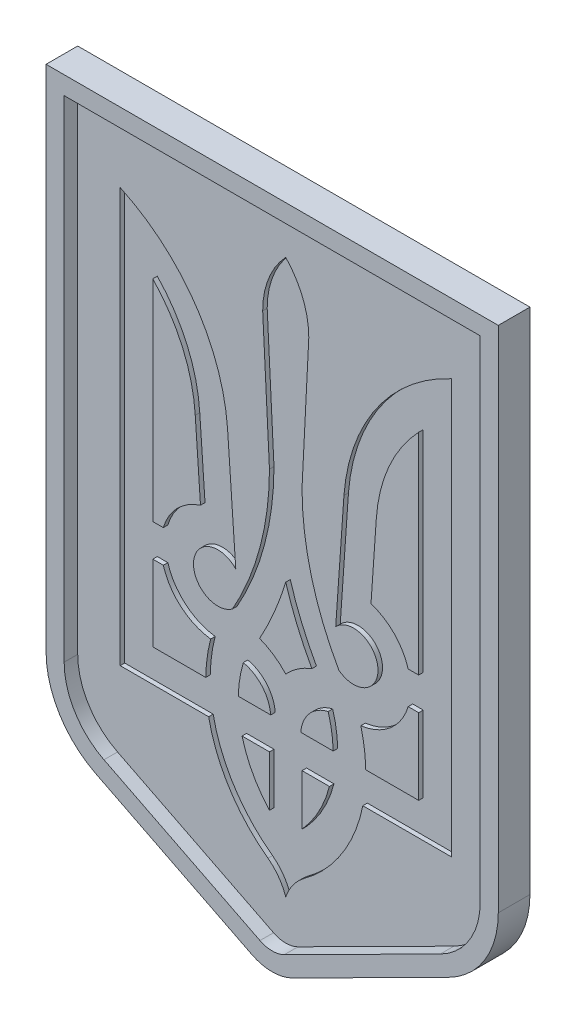
from build123d import *

# Parameters (mm, degrees)
EXTRUDE_1_DEPTH     = 2
EXTRUDE_2_DEPTH     = 1.5
OTHER_START         = 1.5
OTHER_1_DEPTH       = 0.5
CUT_EXTRUDE_1_DEPTH = 10


# Read off the part's stored shape, not the designer's step: Полость1
with BuildPart() as part:
    # Эскиз1 → Бобышка-Вытянуть1 (new body)
    with BuildSketch(Plane.XY):
        with BuildLine():
            Line((-2.248831138, 1.132455321), (-19.497662275, 9.818536847))
            ThreePointArc((-19.497662275, 9.818536847), (-23.514006776, 13.504841411), (-25, 18.75))
            Line((-25, 18.75), (-25, 75))
            Line((-25, 75), (25, 75))
            Line((25, 75), (25, 18.75))
            ThreePointArc((25, 18.75), (23.514006776, 13.504841411), (19.497662275, 9.818536847))
            Line((19.497662275, 9.818536847), (2.248831138, 1.132455321))
            ThreePointArc((2.248831138, 1.132455321), (0, 0.598186897), (-2.248831138, 1.132455321))
        make_face()
    extrude(amount=EXTRUDE_1_DEPTH)

    # Эскиз2 → Бобышка-Вытянуть2 (add)
    with BuildSketch(Plane.XY.offset(2)):
        with BuildLine():
            Line((25, 75), (-25, 75))
            Line((-25, 75), (-25, 18.75))
            ThreePointArc((-25, 18.75), (-23.514006776, 13.504841411), (-19.497662275, 9.818536847))
            Line((-19.497662275, 9.818536847), (-2.248831138, 1.132455321))
            ThreePointArc((-2.248831138, 1.132455321), (0, 0.598186897), (2.248831138, 1.132455321))
            Line((2.248831138, 1.132455321), (19.497662275, 9.818536847))
            ThreePointArc((19.497662275, 9.818536847), (23.514006776, 13.504841411), (25, 18.75))
            Line((25, 18.75), (25, 75))
        make_face()
        with BuildLine():
            Line((23, 73), (-23, 73))
            Line((-23, 73), (-23, 18.75))
            ThreePointArc((-23, 18.75), (-21.81120542, 14.553873129), (-18.59812982, 11.604829477))
            Line((-18.59812982, 11.604829477), (-1.349298683, 2.918747951))
            ThreePointArc((-1.349298683, 2.918747951), (0, 2.598186897), (1.349298683, 2.918747951))
            Line((1.349298683, 2.918747951), (18.59812982, 11.604829477))
            ThreePointArc((18.59812982, 11.604829477), (21.81120542, 14.553873129), (23, 18.75))
            Line((23, 18.75), (23, 73))
        make_face(mode=Mode.SUBTRACT)
    extrude(amount=EXTRUDE_2_DEPTH)

    # Полость1 outline → Полость1 (cut)
    with BuildSketch(Plane.XY.offset(OTHER_START)):
        with BuildLine():
            ThreePointArc((5.872817683, 36.335212556), (10.497140141, 33.683878279), (5.659180925, 31.446003782))
            ThreePointArc((5.659180925, 31.446003782), (2.557547726, 38.996194393), (1.5, 47.089840022))
            Line((1.5, 47.089840022), (2.25, 61.864840022))
            ThreePointArc((2.25, 61.864840022), (1.66872912, 65.046820537), (0, 67.817780472))
            ThreePointArc((0, 67.817780472), (-1.66872912, 65.046820537), (-2.25, 61.864840022))
            Line((-2.25, 61.864840022), (-1.5, 47.089840022))
            ThreePointArc((-1.5, 47.089840022), (-2.557547726, 38.996194393), (-5.659180925, 31.446003782))
            ThreePointArc((-5.659180925, 31.446003782), (-10.49714014, 33.683878279), (-5.872817683, 36.335212556))
            Line((-5.872817683, 36.335212556), (-6.73484174, 48.66273089))
            ThreePointArc((-6.73484174, 48.66273089), (-10.164455559, 58.47909234), (-18, 65.314840022))
            Line((-18, 65.314840022), (-18, 20.314840022))
            Line((-18, 20.314840022), (-8.27498074, 20.314840022))
            ThreePointArc((-8.27498074, 20.314840022), (-6.018005307, 14.531627185), (-1.78373039, 9.991758821))
            ThreePointArc((-1.78373039, 9.991758821), (-0.762703724, 9.010745514), (0, 7.817780472))
            ThreePointArc((0, 7.817780472), (0.762703724, 9.010745514), (1.78373039, 9.991758821))
            ThreePointArc((1.78373039, 9.991758821), (6.018005307, 14.531627185), (8.27498074, 20.314840022))
            Line((8.27498074, 20.314840022), (18, 20.314840022))
            Line((18, 20.314840022), (18, 65.314840022))
            ThreePointArc((18, 65.314840022), (10.164455559, 58.47909234), (6.73484174, 48.66273089))
            Line((6.73484174, 48.66273089), (5.872817683, 36.335212556))
        make_face()
        with BuildLine():
            ThreePointArc((-1.5, 13.673911644), (-3.833724688, 16.727440499), (-5.212446581, 20.314840022))
            Line((-5.212446581, 20.314840022), (-1.5, 20.314840022))
            Line((-1.5, 20.314840022), (-1.5, 13.673911644))
        make_face(mode=Mode.SUBTRACT)
        with BuildLine():
            ThreePointArc((-7.92032189, 27.82958067), (-8.391822285, 25.594060154), (-8.55, 23.314840022))
            Line((-8.55, 23.314840022), (-15, 23.314840022))
            Line((-15, 23.314840022), (-15, 32.314840022))
            Line((-15, 32.314840022), (-13.309475019, 32.314840022))
            ThreePointArc((-13.309475019, 32.314840022), (-11.338226185, 29.203113691), (-7.92032189, 27.82958067))
        make_face(mode=Mode.SUBTRACT)
        with BuildLine():
            ThreePointArc((-4.896666667, 27.463714033), (-2.35750881, 26.043942439), (-1.35, 23.314840022))
            Line((-1.35, 23.314840022), (-5.55, 23.314840022))
            ThreePointArc((-5.55, 23.314840022), (-5.385666463, 25.414840022), (-4.896666667, 27.463714033))
        make_face(mode=Mode.SUBTRACT)
        with BuildLine():
            Line((1.5, 13.673911644), (1.5, 20.314840022))
            Line((1.5, 20.314840022), (5.212446581, 20.314840022))
            ThreePointArc((5.212446581, 20.314840022), (3.833724688, 16.727440499), (1.5, 13.673911644))
        make_face(mode=Mode.SUBTRACT)
        with BuildLine():
            ThreePointArc((1.35, 23.314840022), (2.35750881, 26.043942439), (4.896666667, 27.463714033))
            ThreePointArc((4.896666667, 27.463714033), (5.385666463, 25.414840022), (5.55, 23.314840022))
            Line((5.55, 23.314840022), (1.35, 23.314840022))
        make_face(mode=Mode.SUBTRACT)
        with BuildLine():
            ThreePointArc((0, 38.259555712), (1.403302974, 34.104361284), (3.327405339, 30.163202817))
            ThreePointArc((3.327405339, 30.163202817), (1.502516133, 29.26949151), (0, 27.901505478))
            ThreePointArc((0, 27.901505478), (-1.502516133, 29.26949151), (-3.327405339, 30.163202817))
            ThreePointArc((-3.327405339, 30.163202817), (-1.403302974, 34.104361284), (0, 38.259555712))
        make_face(mode=Mode.SUBTRACT)
        with BuildLine():
            ThreePointArc((8.55, 23.314840022), (8.391822285, 25.594060154), (7.92032189, 27.82958067))
            ThreePointArc((7.92032189, 27.82958067), (11.338226185, 29.203113691), (13.309475019, 32.314840022))
            Line((13.309475019, 32.314840022), (15, 32.314840022))
            Line((15, 32.314840022), (15, 23.314840022))
            Line((15, 23.314840022), (8.55, 23.314840022))
        make_face(mode=Mode.SUBTRACT)
        with BuildLine():
            ThreePointArc((-9.108112452, 39.595322211), (-11.782030233, 38.017722019), (-13.309475019, 35.314840022))
            Line((-13.309475019, 35.314840022), (-15, 35.314840022))
            Line((-15, 35.314840022), (-15, 59.587599146))
            ThreePointArc((-15, 59.587599146), (-11.277427711, 54.369586152), (-9.706680997, 48.155251207))
            Line((-9.706680997, 48.155251207), (-9.108112452, 39.595322211))
        make_face(mode=Mode.SUBTRACT)
        with BuildLine():
            ThreePointArc((9.706680998, 48.155251207), (11.277427711, 54.369586152), (15, 59.587599146))
            Line((15, 59.587599146), (15, 35.314840022))
            Line((15, 35.314840022), (13.309475019, 35.314840022))
            ThreePointArc((13.309475019, 35.314840022), (11.782030233, 38.017722019), (9.108112452, 39.595322211))
            Line((9.108112452, 39.595322211), (9.706680998, 48.155251207))
        make_face(mode=Mode.SUBTRACT)
    extrude(amount=OTHER_1_DEPTH, mode=Mode.SUBTRACT)

    # Эскиз3 → Вырез-Вытянуть1 (cut)
    with BuildSketch(Plane.XY.offset(1.5)):
        with BuildLine():
            Line((-18.3, 65.79134502), (-18.3, 20.014840022))
            Line((-18.3, 20.014840022), (-8.522704696, 20.014840022))
            ThreePointArc((-8.522704696, 20.014840022), (-6.205709985, 14.267416366), (-1.962700971, 9.75097776))
            ThreePointArc((-1.962700971, 9.75097776), (-0.776140503, 8.53640523), (0, 7.026200576))
            ThreePointArc((0, 7.026200576), (0.776140503, 8.53640523), (1.962700971, 9.75097776))
            ThreePointArc((1.962700971, 9.75097776), (6.205709985, 14.267416366), (8.522704696, 20.014840022))
            Line((8.522704696, 20.014840022), (18.3, 20.014840022))
            Line((18.3, 20.014840022), (18.3, 65.79134502))
            ThreePointArc((18.3, 65.79134502), (10.051283209, 58.844723617), (6.435652247, 48.684797911))
            Line((6.435652247, 48.684797911), (5.524546517, 35.655378948))
            ThreePointArc((5.524546517, 35.655378948), (10.188878559, 34.059650346), (5.889417806, 31.647808643))
            ThreePointArc((5.889417806, 31.647808643), (2.840648904, 39.098998924), (1.800000924, 47.0822489))
            Line((1.800000924, 47.0822489), (2.549996836, 61.857168373))
            ThreePointArc((2.549996836, 61.857168373), (1.8904299, 65.304748617), (0, 68.262300456))
            ThreePointArc((0, 68.262300456), (-1.8904299, 65.304748617), (-2.549996836, 61.857168373))
            Line((-2.549996836, 61.857168373), (-1.800000923, 47.0822489))
            ThreePointArc((-1.800000923, 47.0822489), (-2.840648904, 39.098998924), (-5.889417806, 31.647808643))
            ThreePointArc((-5.889417806, 31.647808643), (-10.188878559, 34.059650346), (-5.524546517, 35.655378948))
            Line((-5.524546517, 35.655378948), (-6.435652247, 48.684797911))
            ThreePointArc((-6.435652247, 48.684797911), (-10.051283209, 58.844723617), (-18.3, 65.79134502))
        make_face()
        with BuildLine():
            Line((-14.7, 58.862618748), (-14.7, 35.614840022))
            Line((-14.7, 35.614840022), (-13.537383539, 35.614840022))
            ThreePointArc((-13.537383539, 35.614840022), (-12.000472829, 38.223438928), (-9.424123799, 39.813818902))
            Line((-9.424123799, 39.813818902), (-10.006037257, 48.13556906))
            ThreePointArc((-10.006037257, 48.13556906), (-11.401876329, 53.915296555), (-14.7, 58.862618748))
        make_face(mode=Mode.SUBTRACT)
        with BuildLine():
            Line((10.006037257, 48.13556906), (9.424123799, 39.813818902))
            ThreePointArc((9.424123799, 39.813818902), (12.000472829, 38.223438928), (13.537383539, 35.614840022))
            Line((13.537383539, 35.614840022), (14.7, 35.614840022))
            Line((14.7, 35.614840022), (14.7, 58.862618748))
            ThreePointArc((14.7, 58.862618748), (11.401876329, 53.915296555), (10.006037257, 48.13556906))
        make_face(mode=Mode.SUBTRACT)
        with BuildLine():
            Line((8.847321215, 23.614840022), (14.7, 23.614840022))
            Line((14.7, 23.614840022), (14.7, 32.014840022))
            Line((14.7, 32.014840022), (13.537383539, 32.014840022))
            ThreePointArc((13.537383539, 32.014840022), (11.579925154, 29.014401424), (8.303170174, 27.566246767))
            ThreePointArc((8.303170174, 27.566246767), (8.692930904, 25.606749909), (8.847321215, 23.614840022))
        make_face(mode=Mode.SUBTRACT)
        with BuildLine():
            Line((-5.246590469, 23.614840022), (-1.661555581, 23.614840022))
            ThreePointArc((-1.661555581, 23.614840022), (-2.599333734, 25.86504954), (-4.69, 27.118837919))
            ThreePointArc((-4.69, 27.118837919), (-5.086558291, 25.385624396), (-5.246590469, 23.614840022))
        make_face(mode=Mode.SUBTRACT)
        with BuildLine():
            Line((1.661555581, 23.614840022), (5.246590469, 23.614840022))
            ThreePointArc((5.246590469, 23.614840022), (5.086558291, 25.385624396), (4.69, 27.118837919))
            ThreePointArc((4.69, 27.118837919), (2.599333734, 25.86504954), (1.661555581, 23.614840022))
        make_face(mode=Mode.SUBTRACT)
        with BuildLine():
            Line((-1.8, 20.014840022), (-4.830845042, 20.014840022))
            ThreePointArc((-4.830845042, 20.014840022), (-3.657955571, 17.030306032), (-1.8, 14.416666052))
            Line((-1.8, 14.416666052), (-1.8, 20.014840022))
        make_face(mode=Mode.SUBTRACT)
        with BuildLine():
            Line((4.830845043, 20.014840022), (1.8, 20.014840022))
            Line((1.8, 20.014840022), (1.8, 14.416666052))
            ThreePointArc((1.8, 14.416666052), (3.657955571, 17.030306032), (4.830845043, 20.014840022))
        make_face(mode=Mode.SUBTRACT)
        with BuildLine():
            Line((-13.537383539, 32.014840022), (-14.7, 32.014840022))
            Line((-14.7, 32.014840022), (-14.7, 23.614840022))
            Line((-14.7, 23.614840022), (-8.847321215, 23.614840022))
            ThreePointArc((-8.847321215, 23.614840022), (-8.692930904, 25.606749909), (-8.303170174, 27.566246767))
            ThreePointArc((-8.303170174, 27.566246767), (-11.579925154, 29.014401424), (-13.537383539, 32.014840022))
        make_face(mode=Mode.SUBTRACT)
        with BuildLine():
            ThreePointArc((2.89047704, 30.327467035), (1.328934128, 29.514243453), (0, 28.359391538))
            ThreePointArc((0, 28.359391538), (-1.328934128, 29.514243453), (-2.89047704, 30.327467035))
            ThreePointArc((-2.89047704, 30.327467035), (-1.260735073, 33.666741166), (0, 37.162074866))
            ThreePointArc((0, 37.162074866), (1.260735073, 33.666741166), (2.89047704, 30.327467035))
        make_face(mode=Mode.SUBTRACT)
    extrude(amount=CUT_EXTRUDE_1_DEPTH, mode=Mode.SUBTRACT)


solid = part.part
